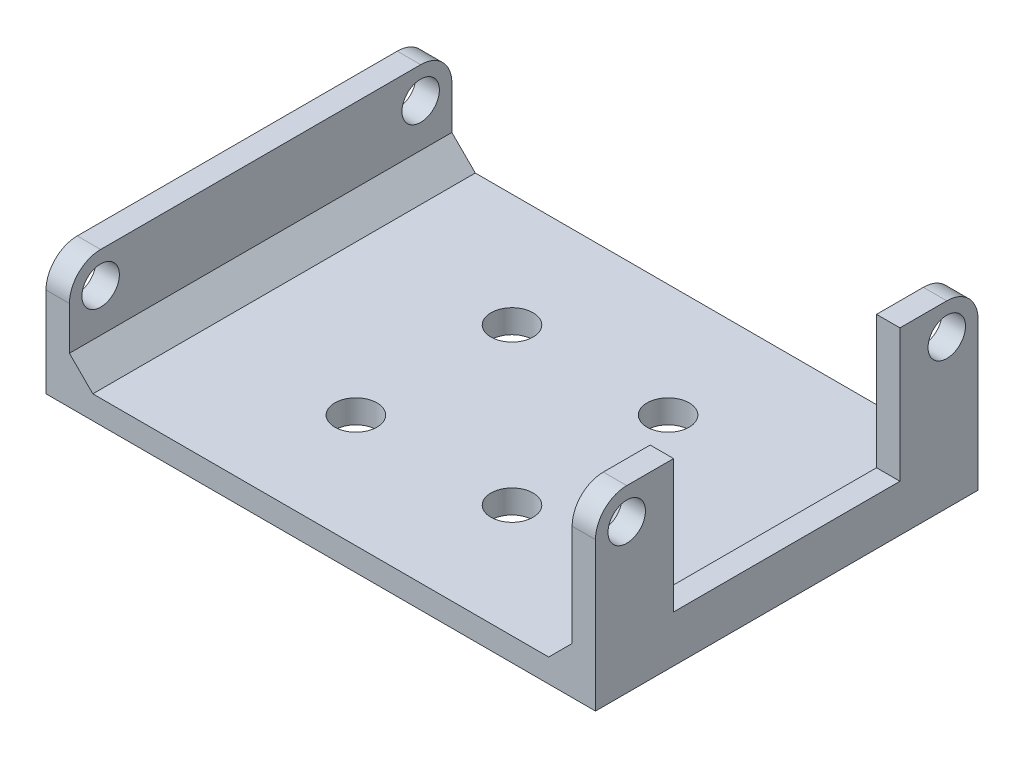
from build123d import *

# Parameters (mm, degrees)
SKETCH1_W           = 35.2
SKETCH1_H           = 24.5
SKETCH1_R           = 1.35
BOSS_EXTRUDE1_DEPTH = 1.5
SKETCH2_R           = 1.2
SKETCH2_W           = 5
SKETCH2_H           = 1.5
SKETCH2_W_2         = 14.5
BOSS_EXTRUDE2_DEPTH = 1.5
SKETCH3_R           = 1.2
BOSS_EXTRUDE3_DEPTH = 1.5
CHAMFER1_SIZE       = 1.5


with BuildPart() as part:
    # Sketch1 → Boss-Extrude1 (new body)
    with BuildSketch(Plane(origin=(0, 0, 0), x_dir=(1, 0, 0), z_dir=(0, 1, 0))):
        Rectangle(SKETCH1_W, SKETCH1_H)
        with Locations(Location((-5, 5, 0), (0, 0, 270))):
            Circle(SKETCH1_R, mode=Mode.SUBTRACT)
        with Locations(Location((5, 5, 0), (0, 0, 90))):
            Circle(SKETCH1_R, mode=Mode.SUBTRACT)
        with Locations(Location((-5, -5, 0), (0, 0, 90))):
            Circle(SKETCH1_R, mode=Mode.SUBTRACT)
        with Locations(Location((5, -5, 0), (0, 0, 270))):
            Circle(SKETCH1_R, mode=Mode.SUBTRACT)
    extrude(amount=BOSS_EXTRUDE1_DEPTH)

    # Sketch2 → Boss-Extrude2 (add)
    # profile 1 of 6: a face of its own
    with BuildSketch(Plane(origin=(17.6, 0, 0), x_dir=(0, 0, -1), z_dir=(1, 0, 0))):
        with BuildLine():
            Line((-7.25, 1.5), (-7.25, 3))
            Line((-7.25, 3), (-7.25, 11.51))
            Line((-7.25, 11.51), (-10.25, 11.51))
            ThreePointArc((-10.25, 11.51), (-11.664213562, 10.924213562), (-12.25, 9.51))
            Line((-12.25, 9.51), (-12.25, 1.5))
            Line((-12.25, 1.5), (-7.25, 1.5))
        make_face()
        with Locations((-10.25, 9.51)):
            Circle(SKETCH2_R, mode=Mode.SUBTRACT)
    # profile 2 of 6: a face of its own
    with BuildSketch(Plane(origin=(17.6, 0, 0), x_dir=(0, 0, -1), z_dir=(1, 0, 0))):
        with Locations((-9.75, 0.75)):
            Rectangle(SKETCH2_W, SKETCH2_H)
    # profile 3 of 6: a face of its own
    with BuildSketch(Plane(origin=(17.6, 0, 0), x_dir=(0, 0, -1), z_dir=(1, 0, 0))):
        with Locations((0, 0.75)):
            Rectangle(SKETCH2_W_2, SKETCH2_H)
    # profile 4 of 6: a face of its own
    with BuildSketch(Plane(origin=(17.6, 0, 0), x_dir=(0, 0, -1), z_dir=(1, 0, 0))):
        with Locations((0, 2.25)):
            Rectangle(SKETCH2_W_2, SKETCH2_H)
    # profile 5 of 6: a face of its own
    with BuildSketch(Plane(origin=(17.6, 0, 0), x_dir=(0, 0, -1), z_dir=(1, 0, 0))):
        with Locations((9.75, 0.75)):
            Rectangle(SKETCH2_W, SKETCH2_H)
    # profile 6 of 6: a face of its own
    with BuildSketch(Plane(origin=(17.6, 0, 0), x_dir=(0, 0, -1), z_dir=(1, 0, 0))):
        with BuildLine():
            Line((7.25, 11.51), (7.25, 3))
            Line((7.25, 3), (7.25, 1.5))
            Line((7.25, 1.5), (12.25, 1.5))
            Line((12.25, 1.5), (12.25, 9.51))
            ThreePointArc((12.25, 9.51), (11.664213562, 10.924213562), (10.25, 11.51))
            Line((10.25, 11.51), (7.25, 11.51))
        make_face()
        with Locations((10.25, 9.51)):
            Circle(SKETCH2_R, mode=Mode.SUBTRACT)
    extrude(amount=-BOSS_EXTRUDE2_DEPTH)

    # Sketch3 → Boss-Extrude3 (add)
    with BuildSketch(Plane.ZY.offset(17.6)):
        with BuildLine():
            Line((-12.25, 0), (12.25, 0))
            Line((12.25, 0), (12.25, 5.76))
            ThreePointArc((12.25, 5.76), (11.664213562, 7.174213562), (10.25, 7.76))
            Line((10.25, 7.76), (-10.25, 7.76))
            ThreePointArc((-10.25, 7.76), (-11.664213562, 7.174213562), (-12.25, 5.76))
            Line((-12.25, 5.76), (-12.25, 0))
        make_face()
        with Locations((-10.25, 5.76)):
            Circle(SKETCH3_R, mode=Mode.SUBTRACT)
        with Locations(Location((10.25, 5.76, 0), (0, 0, 180))):
            Circle(SKETCH3_R, mode=Mode.SUBTRACT)
    extrude(amount=-BOSS_EXTRUDE3_DEPTH)

    # Chamfer1
    chamfer1_edges = [part.edges().sort_by_distance(p)[0] for p in [
        (16.1, 1.5, 0),
        (-16.1, 1.5, 0),
    ]]
    chamfer(chamfer1_edges, length=CHAMFER1_SIZE - 0.0001)  # a hair under: the kernel refuses the full size


solid = part.part
